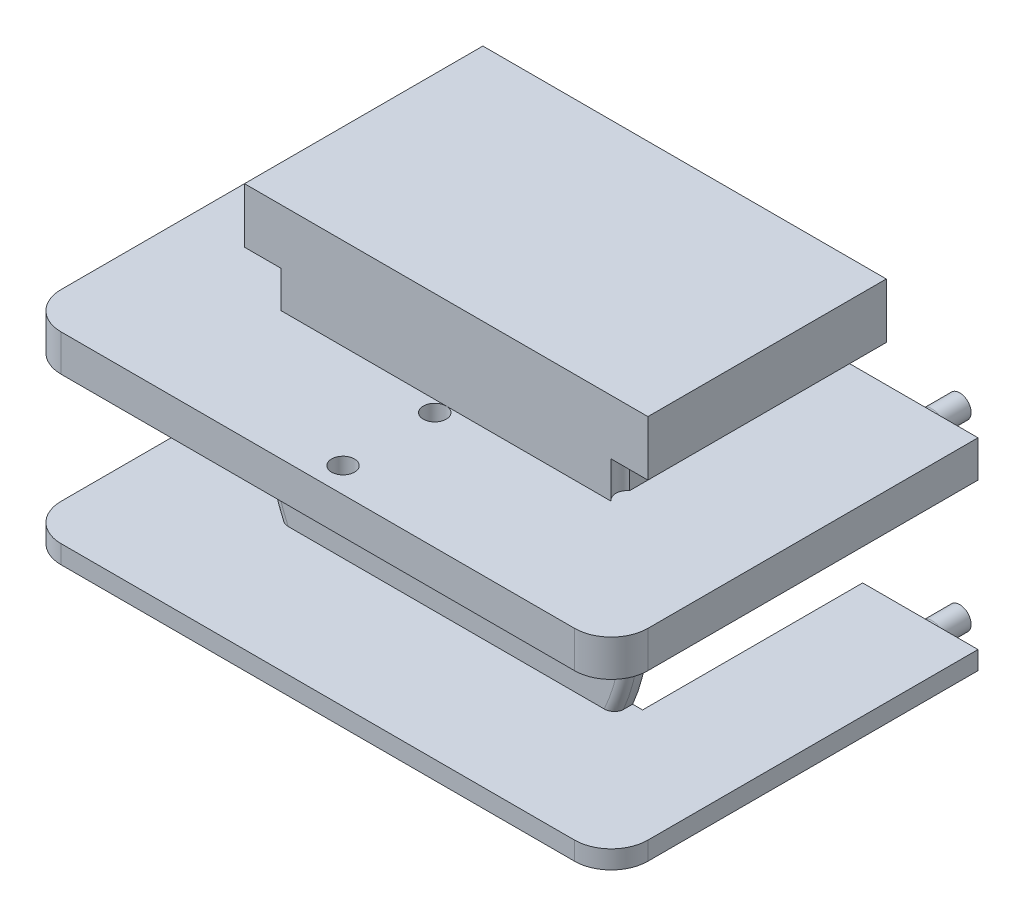
from build123d import *

# Parameters (mm, degrees)
BOSS_EXTRUDE1_DEPTH     = 1
SKETCH2_R               = 1.48
BOSS_EXTRUDE2_DEPTH     = 14
SKETCH3_R               = 1.8
BOSS_EXTRUDE3_DEPTH     = 0.85
SKETCH4_W               = 2
SKETCH4_H               = 17
BOSS_EXTRUDE4_DEPTH     = 12
SKETCH5_W               = 18
SKETCH5_H               = 2
BOSS_EXTRUDE5_DEPTH     = 12
SKETCH6_W               = 13
SKETCH6_H               = 2
BOSS_EXTRUDE6_DEPTH     = 5
BOSS_EXTRUDE7_DEPTH     = 12
CUT_EXTRUDE1_DEPTH      = 24.366642891
SKETCH9_W               = 2.937742252
SKETCH9_H               = 8
CUT_EXTRUDE2_DEPTH      = 12
CUT_EXTRUDE11_START     = -12
SKETCH21_R              = 10.5
SKETCH21_R_2            = 1.8
CUT_EXTRUDE11_DEPTH     = 12
SKETCH10_W              = 32
SKETCH10_H              = 2
BOSS_EXTRUDE8_DEPTH     = 7
FILLET1_R               = 0.5
SKETCH11_R              = 0.625
BOSS_EXTRUDE9_DEPTH     = 2
SKETCH14_W              = 2
SKETCH14_H              = 2
CUT_EXTRUDE5_DEPTH      = 28.874719859
SKETCH12_R              = 0.675
CUT_EXTRUDE3_DEPTH      = 2.5
CUT_EXTRUDE6_DEPTH      = 2
FILLET2_R               = 0.5
FILLET3_R               = 0.5
FILLET4_R               = 2
CUT_EXTRUDE7_DEPTH      = 28.221315288
CUT_EXTRUDE7_DEPTH_BACK = 1
SKETCH19_R              = 0.625
CUT_EXTRUDE9_DEPTH      = 2
FILLET5_R               = 0.4


with BuildPart() as part:
    # Sketch1 → Boss-Extrude1 (new body)
    with BuildSketch(Plane.XY):
        Polygon((-11, 6), (-11, 11), (11, 11), (11, 6), (11, -6), (-11, -6), align=None)
    extrude(amount=BOSS_EXTRUDE1_DEPTH)

    # Sketch2 → Boss-Extrude2 (add)
    with BuildSketch(Plane(origin=(0, 0, 0), x_dir=(-1, 0, 0), z_dir=(0, 0, -1))):
        with Locations(Location((0, 0, 0), (0, 0, 180))):
            Circle(SKETCH2_R)
    extrude(amount=BOSS_EXTRUDE2_DEPTH)

    # Sketch3 → Boss-Extrude3 (add)
    with BuildSketch(Plane(origin=(0, 0, 0), x_dir=(-1, 0, 0), z_dir=(0, 0, -1))):
        with Locations(Location((0, 0, 0), (0, 0, 180))):
            Circle(SKETCH3_R)
    extrude(amount=BOSS_EXTRUDE3_DEPTH)

    # Sketch4 → Boss-Extrude4 (add)
    with BuildSketch(Plane(origin=(0, 0, 0), x_dir=(-1, 0, 0), z_dir=(0, 0, -1))):
        with Locations((10, 2.5)):
            Rectangle(SKETCH4_W, SKETCH4_H)
        with Locations((-10, 2.5)):
            Rectangle(SKETCH4_W, SKETCH4_H)
    extrude(amount=BOSS_EXTRUDE4_DEPTH)

    # Sketch5 → Boss-Extrude5 (add)
    with BuildSketch(Plane(origin=(0, 0, 0), x_dir=(-1, 0, 0), z_dir=(0, 0, -1))):
        with Locations((0, 10)):
            Rectangle(SKETCH5_W, SKETCH5_H)
    extrude(amount=BOSS_EXTRUDE5_DEPTH)

    # Sketch6 → Boss-Extrude6 (add)
    with BuildSketch(Plane(origin=(11, 0, 0), x_dir=(0, 0, -1), z_dir=(1, 0, 0))):
        with Locations((5.5, -5)):
            Rectangle(SKETCH6_W, SKETCH6_H)
        with Locations((5.5, 5)):
            Rectangle(SKETCH6_W, SKETCH6_H)
    boss_extrude6 = extrude(amount=BOSS_EXTRUDE6_DEPTH)

    # Mirror1: Boss-Extrude6 across plane
    add(boss_extrude6.mirror(Plane(origin=(0, 0, 0), x_dir=(0, 0, 1), z_dir=(1, 0, 0))))

    # Sketch7 → Boss-Extrude7 (add)
    with BuildSketch(Plane(origin=(0, 0, -12), x_dir=(-1, 0, 0), z_dir=(0, 0, -1))):
        with BuildLine():
            ThreePointArc((-6.708203932, -6), (-8.407551231, -3.211398808), (-9, 0))
            Line((-9, 0), (-9, -6))
            Line((-9, -6), (-6.708203932, -6))
        make_face()
        with BuildLine():
            Line((-9, 9), (-9, 0))
            ThreePointArc((-9, 0), (-6.363961031, 6.363961031), (0, 9))
            Line((0, 9), (-9, 9))
        make_face()
    boss_extrude7 = extrude(amount=-BOSS_EXTRUDE7_DEPTH)

    # Sketch8 → Cut-Extrude1 (cut, through all)
    with BuildSketch(Plane(origin=(0, 0, -12), x_dir=(-1, 0, 0), z_dir=(0, 0, -1))):
        with BuildLine():
            Line((-11, 4), (-9.16515139, 4))
            ThreePointArc((-9.16515139, 4), (-10, 0), (-9.16515139, -4))
            Line((-9.16515139, -4), (-11, -4))
            Line((-11, -4), (-11, 4))
        make_face()
    cut_extrude1 = extrude(amount=-CUT_EXTRUDE1_DEPTH, mode=Mode.SUBTRACT)

    # Sketch9 → Cut-Extrude2 (cut)
    with BuildSketch(Plane(origin=(0, 0, -12), x_dir=(-1, 0, 0), z_dir=(0, 0, -1))):
        with Locations((-9.531128874, 0)):
            Rectangle(SKETCH9_W, SKETCH9_H)
    cut_extrude2 = extrude(amount=-CUT_EXTRUDE2_DEPTH, mode=Mode.SUBTRACT)

    # Mirror2: Boss-Extrude7, Cut-Extrude1, Cut-Extrude2 across plane
    add(boss_extrude7.mirror(Plane(origin=(0, 0, 0), x_dir=(0, 0, 1), z_dir=(1, 0, 0))))
    add(cut_extrude1.mirror(Plane(origin=(0, 0, 0), x_dir=(0, 0, 1), z_dir=(1, 0, 0))), mode=Mode.SUBTRACT)
    add(cut_extrude2.mirror(Plane(origin=(0, 0, 0), x_dir=(0, 0, 1), z_dir=(1, 0, 0))), mode=Mode.SUBTRACT)

    # Sketch21 → Cut-Extrude11 (cut)
    with BuildSketch(Plane(origin=(0, 0, -12), x_dir=(-1, 0, 0), z_dir=(0, 0, -1)).offset(CUT_EXTRUDE11_START)):
        Circle(SKETCH21_R)
        with Locations(Location((0, 0, 0), (0, 0, 180))):
            Circle(SKETCH21_R_2, mode=Mode.SUBTRACT)
    extrude(amount=CUT_EXTRUDE11_DEPTH, mode=Mode.SUBTRACT)

    # Sketch10 → Boss-Extrude8 (add)
    with BuildSketch(Plane.XY.offset(1)):
        with Locations((0, -5)):
            Rectangle(SKETCH10_W, SKETCH10_H)
        with Locations((0, 5)):
            Rectangle(SKETCH10_W, SKETCH10_H)
    extrude(amount=BOSS_EXTRUDE8_DEPTH)

    # Fillet1
    fillet1_edges = [part.edges().sort_by_distance(p)[0] for p in [
        (10, 0, 1),
        (-10, 0, 1),
    ]]
    fillet(fillet1_edges, radius=FILLET1_R)

    # Sketch11 → Boss-Extrude9 (add)
    with BuildSketch(Plane(origin=(0, 0, -12), x_dir=(-1, 0, 0), z_dir=(0, 0, -1))):
        with Locations(Location((-13, -5, 0), (0, 0, 180))):
            Circle(SKETCH11_R)
    boss_extrude9 = extrude(amount=BOSS_EXTRUDE9_DEPTH)

    # Sketch14 → Cut-Extrude5 (cut, through all)
    with BuildSketch(Plane(origin=(0, 0, -12), x_dir=(-1, 0, 0), z_dir=(0, 0, -1))):
        with Locations((10, 7)):
            Rectangle(SKETCH14_W, SKETCH14_H)
        with Locations((-10, 7)):
            Rectangle(SKETCH14_W, SKETCH14_H)
    extrude(amount=-CUT_EXTRUDE5_DEPTH, mode=Mode.SUBTRACT)

    # Sketch12 → Cut-Extrude3 (cut)
    with BuildSketch(Plane(origin=(0, 0, -12), x_dir=(-1, 0, 0), z_dir=(0, 0, -1))):
        with Locations((13, -5)):
            Circle(SKETCH12_R)
    cut_extrude3 = extrude(amount=-CUT_EXTRUDE3_DEPTH, mode=Mode.SUBTRACT)

    # Sketch16 → Cut-Extrude6 (cut)
    with BuildSketch(Plane(origin=(0, 6, 0), x_dir=(1, 0, 0), z_dir=(0, 1, 0))):
        with BuildLine():
            Line((-9, 0), (-9, -1))
            ThreePointArc((-9, -1), (-8.75, -0.5), (-9, 0))
        make_face()
    cut_extrude6 = extrude(amount=CUT_EXTRUDE6_DEPTH, mode=Mode.SUBTRACT)

    # Mirror3: Boss-Extrude9, Cut-Extrude3 across plane
    add(boss_extrude9.mirror(Plane.ZX))
    add(cut_extrude3.mirror(Plane.ZX), mode=Mode.SUBTRACT)

    # Mirror4: Cut-Extrude6 across plane
    add(cut_extrude6.mirror(Plane(origin=(0, 0, 0), x_dir=(0, 0, 1), z_dir=(1, 0, 0))), mode=Mode.SUBTRACT)

    # Fillet2
    fillet2_edges = [part.edges().sort_by_distance(p)[0] for p in [
        (12.375, -5, -12),
        (12.375, 5, -12),
    ]]
    fillet(fillet2_edges, radius=FILLET2_R)

    # Fillet3
    # the kernel refuses this fillet: 0.5 mm, written as the material it takes off along each edge
    with BuildSketch(Plane(origin=(-13, -5, -12), x_dir=(-1, 0, 0), z_dir=(0, -1, 0))) as fillet3_piece_1:
        with BuildLine():
            CenterArc((0.675 + FILLET3_R, -FILLET3_R), FILLET3_R, 90, 90)
            Line((0.675, -FILLET3_R), (0.675, 0))
            Line((0.675, 0), (0.675 + FILLET3_R, 0))
        make_face()
    revolve(axis=Axis((-13, -5, -12), (0, 0, -1)), mode=Mode.SUBTRACT)
    with BuildSketch(Plane(origin=(-13, 5, -12), x_dir=(-1, 0, 0), z_dir=(0, 1, 0))) as fillet3_piece_2:
        with BuildLine():
            CenterArc((0.675 + FILLET3_R, FILLET3_R), FILLET3_R, 180, 90)
            Line((0.675, FILLET3_R), (0.675, 0))
            Line((0.675, 0), (0.675 + FILLET3_R, 0))
        make_face()
    revolve(axis=Axis((-13, 5, -12), (0, 0, 1)), mode=Mode.SUBTRACT)

    # Fillet4
    fillet4_edges = [part.edges().sort_by_distance(p)[0] for p in [
        (16, -5, 8),
        (-16, -5, 8),
        (-16, 5, 8),
        (16, 5, 8),
    ]]
    fillet(fillet4_edges, radius=FILLET4_R)

    # Sketch17 → Cut-Extrude7 (cut, two sides: drawn at the far end of the back side and taken through both)
    with BuildSketch(Plane.XZ.offset(6).offset(-CUT_EXTRUDE7_DEPTH_BACK)):
        with BuildLine():
            Line((-16, 6), (-16, -12))
            Line((-16, -12), (-14.5, -12))
            Line((-14.5, -12), (-14.5, 6))
            ThreePointArc((-14.5, 6), (-14.353553391, 6.353553391), (-14, 6.5))
            Line((-14, 6.5), (14, 6.5))
            ThreePointArc((14, 6.5), (14.353553391, 6.353553391), (14.5, 6))
            Line((14.5, 6), (14.5, -12))
            Line((14.5, -12), (16, -12))
            Line((16, -12), (16, 6))
            ThreePointArc((16, 6), (15.414213562, 7.414213562), (14, 8))
            Line((14, 8), (-14, 8))
            ThreePointArc((-14, 8), (-15.414213562, 7.414213562), (-16, 6))
        make_face()
    extrude(amount=CUT_EXTRUDE7_DEPTH + CUT_EXTRUDE7_DEPTH_BACK, mode=Mode.SUBTRACT)

    # Sketch19 → Cut-Extrude9 (cut)
    with BuildSketch(Plane(origin=(0, 6, 0), x_dir=(1, 0, 0), z_dir=(0, 1, 0))):
        with Locations(Location((0, -1.625, 0), (0, 0, 90))):
            Circle(SKETCH19_R)
        with Locations(Location((0, -6.625, 0), (0, 0, 270))):
            Circle(SKETCH19_R)
    extrude(amount=-CUT_EXTRUDE9_DEPTH, mode=Mode.SUBTRACT)

    # Fillet5
    fillet5_edges = [part.edges().sort_by_distance(p)[0] for p in [
        (-1.48, 0, -14),
    ]]
    fillet(fillet5_edges, radius=FILLET5_R)


solid = part.part
